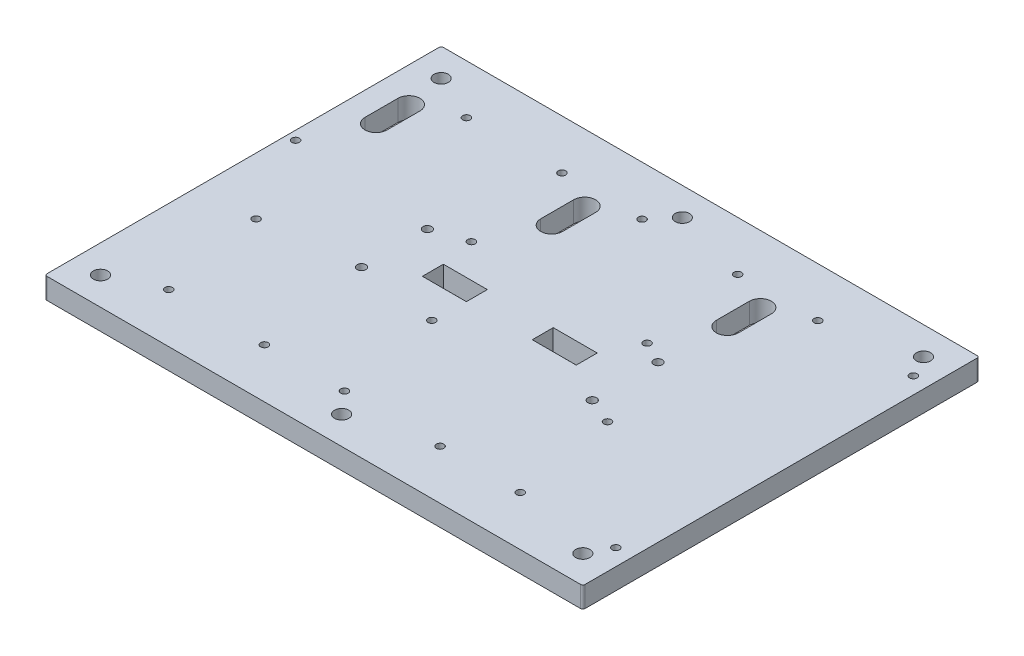
from build123d import *

# Parameters (mm, degrees)
SKETCH1_W           = 245
SKETCH1_H           = 180.5
BOSS_EXTRUDE1_DEPTH = 9.525
SKETCH1_5_R         = 1.7
CUT_EXTRUDE2_DEPTH  = 153.453396568
SKETCH4_R           = 1.985
SKETCH4_W           = 20.02
SKETCH4_H           = 9.545
CUT_EXTRUDE4_DEPTH  = 153.453396568
SKETCH7_R           = 3.25
CUT_EXTRUDE5_DEPTH  = 153.453396568
SKETCH9_R           = 1.7
CUT_EXTRUDE6_DEPTH  = 153.453396568
FILLET1_R           = 1


with BuildPart() as part:
    # Sketch1 → Boss-Extrude1 (new body)
    with BuildSketch(Plane(origin=(0, 0, 0), x_dir=(1, 0, 0), z_dir=(0, 1, 0))):
        Rectangle(SKETCH1_W, SKETCH1_H)
    extrude(amount=-BOSS_EXTRUDE1_DEPTH)

    # Sketch1<5> → Cut-Extrude2 (cut, through all)
    with BuildSketch(Plane(origin=(0, 0, 0), x_dir=(1, 0, 0), z_dir=(0, 1, 0))):
        with Locations((-88.53, 67.75)):
            Circle(SKETCH1_5_R)
        with Locations((-88.53, -67.75)):
            Circle(SKETCH1_5_R)
        with Locations((-45, -67.75)):
            Circle(SKETCH1_5_R)
        with Locations((-45, 67.75)):
            Circle(SKETCH1_5_R)
        with Locations((-8.53, 67.75)):
            Circle(SKETCH1_5_R)
        with Locations((-8.53, -67.75)):
            Circle(SKETCH1_5_R)
        with Locations((35, -67.75)):
            Circle(SKETCH1_5_R)
        with Locations((35, 67.75)):
            Circle(SKETCH1_5_R)
        with Locations((71.47, 67.75)):
            Circle(SKETCH1_5_R)
        with Locations((71.47, -67.75)):
            Circle(SKETCH1_5_R)
        with Locations((115, -67.75)):
            Circle(SKETCH1_5_R)
        with Locations((115, 67.75)):
            Circle(SKETCH1_5_R)
    extrude(amount=-CUT_EXTRUDE2_DEPTH, mode=Mode.SUBTRACT)

    # Sketch4 → Cut-Extrude4 (cut, through all)
    with BuildSketch(Plane.XZ.offset(9.525)):
        with Locations((-53.5, 15)):
            Circle(SKETCH4_R)
        with Locations((51.5, 15)):
            Circle(SKETCH4_R)
        with Locations((51.5, -15)):
            Circle(SKETCH4_R)
        with Locations((-53.5, -15)):
            Circle(SKETCH4_R)
        with Locations((-26.01, 0)):
            Rectangle(SKETCH4_W, SKETCH4_H)
        with Locations((24.01, 0)):
            Rectangle(SKETCH4_W, SKETCH4_H)
    extrude(amount=-CUT_EXTRUDE4_DEPTH, mode=Mode.SUBTRACT)

    # Sketch7 → Cut-Extrude5 (cut, through all)
    with BuildSketch(Plane.XZ.offset(9.525)):
        with Locations((-109.8, 77.55)):
            Circle(SKETCH7_R)
        with Locations((0, 77.55)):
            Circle(SKETCH7_R)
        with Locations((109.8, 77.55)):
            Circle(SKETCH7_R)
        with Locations((-109.8, -77.55)):
            Circle(SKETCH7_R)
        with Locations((0, -77.55)):
            Circle(SKETCH7_R)
        with Locations((109.8, -77.55)):
            Circle(SKETCH7_R)
    extrude(amount=-CUT_EXTRUDE5_DEPTH, mode=Mode.SUBTRACT)

    # Sketch9 → Cut-Extrude6 (cut, through all)
    with BuildSketch(Plane(origin=(0, 0, 0), x_dir=(1, 0, 0), z_dir=(0, 1, 0))):
        with Locations((41.485, 20)):
            Circle(SKETCH9_R)
        with Locations((63.485, -20)):
            Circle(SKETCH9_R)
        with Locations((-38.515, 20)):
            Circle(SKETCH9_R)
        with Locations((-16.515, -20)):
            Circle(SKETCH9_R)
        with Locations((-118.515, 20)):
            Circle(SKETCH9_R)
        with Locations((-96.515, -20)):
            Circle(SKETCH9_R)
        with BuildLine():
            Line((58.235, 59.85), (58.235, 44.85))
            ThreePointArc((58.235, 44.85), (53.235, 39.85), (48.235, 44.85))
            Line((48.235, 44.85), (48.235, 59.85))
            ThreePointArc((48.235, 59.85), (53.235, 64.85), (58.235, 59.85))
        make_face()
        with BuildLine():
            Line((-21.765, 59.85), (-21.765, 44.85))
            ThreePointArc((-21.765, 44.85), (-26.765, 39.85), (-31.765, 44.85))
            Line((-31.765, 44.85), (-31.765, 59.85))
            ThreePointArc((-31.765, 59.85), (-26.765, 64.85), (-21.765, 59.85))
        make_face()
        with BuildLine():
            Line((-101.765, 59.85), (-101.765, 44.85))
            ThreePointArc((-101.765, 44.85), (-106.765, 39.85), (-111.765, 44.85))
            Line((-111.765, 44.85), (-111.765, 59.85))
            ThreePointArc((-111.765, 59.85), (-106.765, 64.85), (-101.765, 59.85))
        make_face()
    extrude(amount=-CUT_EXTRUDE6_DEPTH, mode=Mode.SUBTRACT)

    # Fillet1
    fillet1_edges = [part.edges().sort_by_distance(p)[0] for p in [
        (-122.5, -4.7625, -90.25),
        (-122.5, -4.7625, 90.25),
        (122.5, -4.7625, 90.25),
        (122.5, -4.7625, -90.25),
    ]]
    fillet(fillet1_edges, radius=FILLET1_R)


solid = part.part
